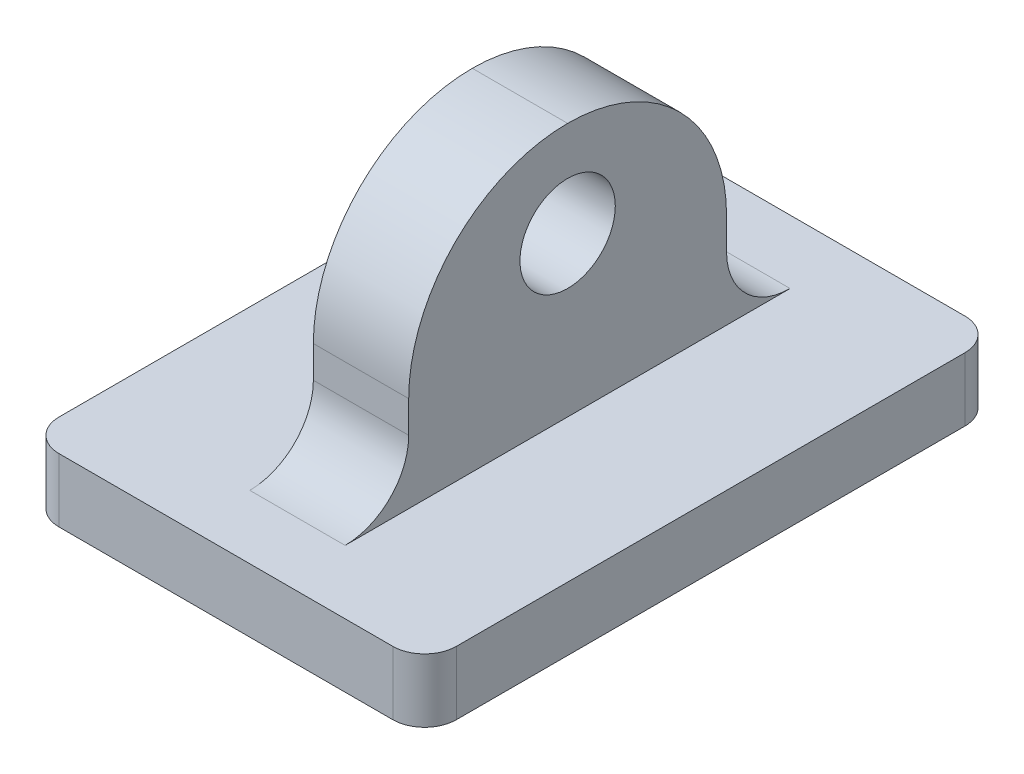
from build123d import *

# Parameters (mm, degrees)
SKETCH1_W                = 70
SKETCH1_H                = 150
BOSS_EXTRUDE1_DEPTH      = 5
SKETCH2_W                = 3
SKETCH2_H                = 15
BOSS_EXTRUDE3_DEPTH      = 20
SKETCH2_5_W              = 16
SKETCH2_5_H              = 22
SKETCH2_5_W_2            = 3
SKETCH2_5_H_2            = 15
BOSS_EXTRUDE4_DEPTH      = 5
CHAMFER1_SIZE            = 3
SKETCH3_R                = 3
CUT_EXTRUDE1_DEPTH       = 89.600225733
CHAMFER3_SIZE            = 1
CHAMFER4_SIZE            = 1
CHAMFER5_SIZE            = 3
CHAMFER6_SIZE            = 3
CHAMFER7_SIZE            = 20
CHAMFER8_SIZE            = 10
SKETCH4_W                = 3
SKETCH4_H                = 10
BOSS_EXTRUDE5_DEPTH      = 10
SKETCH6_R                = 1.5
CUT_EXTRUDE2_DEPTH       = 88.076116128
FILLET1_R                = 5
CHAMFER10_SIZE           = 1
CUT_EXTRUDE3_DEPTH       = 87
BOSS_EXTRUDE6_DEPTH      = 5
BOSS_EXTRUDE6_DEPTH_BACK = 7.5
SKETCH8_W                = 18
SKETCH8_H                = 2
FILLET2_R                = 2
FILLET3_R                = 1


# Some blends are built 0.0001 mm under size
with BuildPart() as part:
    # Sketch1 → Boss-Extrude1 (new body)
    with BuildSketch(Plane(origin=(0, 0, 0), x_dir=(1, 0, 0), z_dir=(0, 1, 0))):
        Rectangle(SKETCH1_W, SKETCH1_H)
    extrude(amount=BOSS_EXTRUDE1_DEPTH)

    # Sketch2 → Boss-Extrude3 (add)
    with BuildSketch(Plane(origin=(0, 5, 0), x_dir=(1, 0, 0), z_dir=(0, 1, 0))):
        with Locations((3.5, 62.5)):
            Rectangle(SKETCH2_W, SKETCH2_H)
        with Locations((-3.5, 62.5)):
            Rectangle(SKETCH2_W, SKETCH2_H)
    extrude(amount=BOSS_EXTRUDE3_DEPTH)

    # Sketch2<5> → Boss-Extrude4 (add)
    with BuildSketch(Plane(origin=(0, 5, 0), x_dir=(1, 0, 0), z_dir=(0, 1, 0))):
        with Locations((0, 62.5)):
            Rectangle(SKETCH2_5_W, SKETCH2_5_H)
        with Locations((-3.5, 62.5)):
            Rectangle(SKETCH2_5_W_2, SKETCH2_5_H_2, mode=Mode.SUBTRACT)
        with Locations((3.5, 62.5)):
            Rectangle(SKETCH2_5_W_2, SKETCH2_5_H_2, mode=Mode.SUBTRACT)
    extrude(amount=BOSS_EXTRUDE4_DEPTH)

    # Chamfer1
    chamfer1_edges = [part.edges().sort_by_distance(p)[0] for p in [
        (0, 10, -73.5),
        (0, 10, -51.5),
    ]]
    chamfer(chamfer1_edges, length=CHAMFER1_SIZE)

    # Sketch3 → Cut-Extrude1 (cut, through all)
    with BuildSketch(Plane(origin=(5, 0, 0), x_dir=(0, 0, -1), z_dir=(1, 0, 0))):
        with Locations((62.5, 23.2)):
            Circle(SKETCH3_R)
    extrude(amount=-CUT_EXTRUDE1_DEPTH, mode=Mode.SUBTRACT)

    # Chamfer3
    # the kernel refuses this chamfer: 1, 0.714285714 mm, written as the material it takes off along each edge
    with BuildSketch(Plane(origin=(-7.571682988, 25, -64.9), x_dir=(0, -0.8672694366120031, -0.4978390546338231), z_dir=(1, 0, 0)), Plane(origin=(-0.571682988, 25, -64.9), x_dir=(0, -0.8672694366120031, -0.4978390546338231), z_dir=(1, 0, 0))) as chamfer3_piece_1:
        with BuildLine():
            Line((0.73254251, 0), (CHAMFER3_SIZE * 0.497839054634, CHAMFER3_SIZE * 0.867269436612))
            Line((CHAMFER3_SIZE * 0.497839054634, CHAMFER3_SIZE * 0.867269436612), (0, 0))
            ThreePointArc((0, 0), (0.371569513, 0.022438375), (0.73254251, 0))
        make_face()
    extrude(amount=8.143365976, mode=Mode.SUBTRACT)
    with BuildSketch(Plane(origin=(-7.571682988, 25, -60.1), x_dir=(0, 0, 1), z_dir=(1, 0, 0)), Plane(origin=(-0.571682988, 25, -60.1), x_dir=(0, 0, 1), z_dir=(1, 0, 0))) as chamfer3_piece_2:
        with BuildLine():
            Line((CHAMFER3_SIZE, 0), (0.36468827, 0.63531173))
            ThreePointArc((0.36468827, 0.63531173), (0.204441932, 0.311080183), (0, 0))
            Line((0, 0), (CHAMFER3_SIZE, 0))
        make_face()
    extrude(amount=8.143365976, mode=Mode.SUBTRACT)

    # Chamfer4
    chamfer4_edges = [part.edges().sort_by_distance(p)[0] for p in [
        (3.5, 25, -70),
        (3.5, 25, -55),
        (-3.5, 25, -70),
        (-3.5, 25, -55),
    ]]
    chamfer(chamfer4_edges, length=CHAMFER4_SIZE)

    # Chamfer5
    # the kernel refuses this chamfer: 3 mm, written as the material it adds along each edge
    with BuildSketch(Plane(origin=(-8, 5, -73.5), x_dir=(0, 1, 0), z_dir=(0, 0, 1))) as chamfer5_piece_1_section:
        Polygon((CHAMFER5_SIZE, 0), (0, CHAMFER5_SIZE), (0, 0), align=None)
    chamfer5_piece_1 = extrude(amount=22, mode=Mode.PRIVATE)
    chamfer5_piece_1 = split(chamfer5_piece_1, bisect_by=Plane(origin=(-8, 17, -61.5), z_dir=(0, -0.7071067811865476, -0.7071067811865476)), keep=Keep.TOP, mode=Mode.PRIVATE)
    chamfer5_piece_1 = split(chamfer5_piece_1, bisect_by=Plane(origin=(-8, 6, -74.5), z_dir=(0, -0.7071067811865476, 0.7071067811865476)), keep=Keep.TOP, mode=Mode.PRIVATE)
    add(chamfer5_piece_1)
    with BuildSketch(Plane(origin=(8, 5, -51.5), x_dir=(0, 1, 0), z_dir=(0, 0, -1))) as chamfer5_piece_2_section:
        Polygon((CHAMFER5_SIZE, 0), (0, CHAMFER5_SIZE), (0, 0), align=None)
    chamfer5_piece_2 = extrude(amount=22, mode=Mode.PRIVATE)
    chamfer5_piece_2 = split(chamfer5_piece_2, bisect_by=Plane(origin=(8, 6, -50.5), z_dir=(0, -0.7071067811865476, -0.7071067811865476)), keep=Keep.TOP, mode=Mode.PRIVATE)
    chamfer5_piece_2 = split(chamfer5_piece_2, bisect_by=Plane(origin=(8, 17, -63.5), z_dir=(0, -0.7071067811865476, 0.7071067811865476)), keep=Keep.TOP, mode=Mode.PRIVATE)
    add(chamfer5_piece_2)

    # Chamfer6
    chamfer6_edges = [part.edges().sort_by_distance(p)[0] for p in [
        (-5, 10, -62.5),
        (5, 10, -62.5),
    ]]
    chamfer(chamfer6_edges, length=CHAMFER6_SIZE - 0.0001)  # a hair under: the kernel refuses the full size

    # Chamfer7
    chamfer7_edges = [part.edges().sort_by_distance(p)[0] for p in [
        (35, 2.5, 75),
        (-35, 2.5, 75),
    ]]
    chamfer(chamfer7_edges, length=CHAMFER7_SIZE)

    # Chamfer8
    chamfer8_edges = [part.edges().sort_by_distance(p)[0] for p in [
        (-35, 2.5, -75),
        (35, 2.5, -75),
    ]]
    chamfer(chamfer8_edges, length=CHAMFER8_SIZE)

    # Sketch4 → Boss-Extrude5 (add)
    with BuildSketch(Plane(origin=(0, 5, 0), x_dir=(1, 0, 0), z_dir=(0, 1, 0))):
        with Locations((0, -70)):
            Rectangle(SKETCH4_W, SKETCH4_H)
    extrude(amount=BOSS_EXTRUDE5_DEPTH)

    # Sketch6 → Cut-Extrude2 (cut, through all)
    with BuildSketch(Plane(origin=(1.5, 0, 0), x_dir=(0, 0, -1), z_dir=(1, 0, 0))):
        with Locations((-70, 12)):
            Circle(SKETCH6_R)
    extrude(amount=-CUT_EXTRUDE2_DEPTH, mode=Mode.SUBTRACT)

    # Fillet1
    fillet1_edges = [part.edges().sort_by_distance(p)[0] for p in [
        (0, 15, 75),
        (0, 15, 65),
    ]]
    fillet(fillet1_edges, radius=FILLET1_R - 0.0001)  # a hair under: the kernel refuses the full size

    # Chamfer10
    chamfer10_edges = [part.edges().sort_by_distance(p)[0] for p in [
        (0, 0, 75),
        (35, 0, -5),
        (25, 0, 65),
        (-25, 0, 65),
        (-35, 0, -5),
        (0, 0, -75),
        (30, 0, -70),
        (-30, 0, -70),
    ]]
    chamfer(chamfer10_edges, length=CHAMFER10_SIZE)

    # Sketch7 → Cut-Extrude3 (cut)
    with BuildSketch(Plane.ZY.offset(35)):
        Polygon((-104.766483953, 57.568464944), (-5.977667253, 57.568464944), (-5.977667253, 5), (81.485043075, 5), (81.485043075, -30.208859449), (-5.977667253, -30.208859449), (-5.977667253, -7.084725604), (-104.766483953, -7.084725604), align=None)
    extrude(amount=-CUT_EXTRUDE3_DEPTH, mode=Mode.SUBTRACT)

    # Sketch8 → Boss-Extrude6 (add, two sides: drawn at the far end of the back side and taken through both)
    with BuildSketch(Plane.ZY.offset(1.5).offset(-BOSS_EXTRUDE6_DEPTH_BACK)):
        with Locations((70, 6)):
            Rectangle(SKETCH8_W, SKETCH8_H)
    extrude(amount=BOSS_EXTRUDE6_DEPTH + BOSS_EXTRUDE6_DEPTH_BACK)

    # Fillet2
    fillet2_edges = [part.edges().sort_by_distance(p)[0] for p in [
        (0, 7, 75),
        (0, 7, 65),
    ]]
    fillet(fillet2_edges, radius=FILLET2_R)

    # Fillet3
    fillet3_edges = [part.edges().sort_by_distance(p)[0] for p in [
        (6, 6, 61),
        (6, 6, 79),
        (-6.5, 6, 61),
        (-6.5, 6, 79),
    ]]
    fillet(fillet3_edges, radius=FILLET3_R)


solid = part.part
